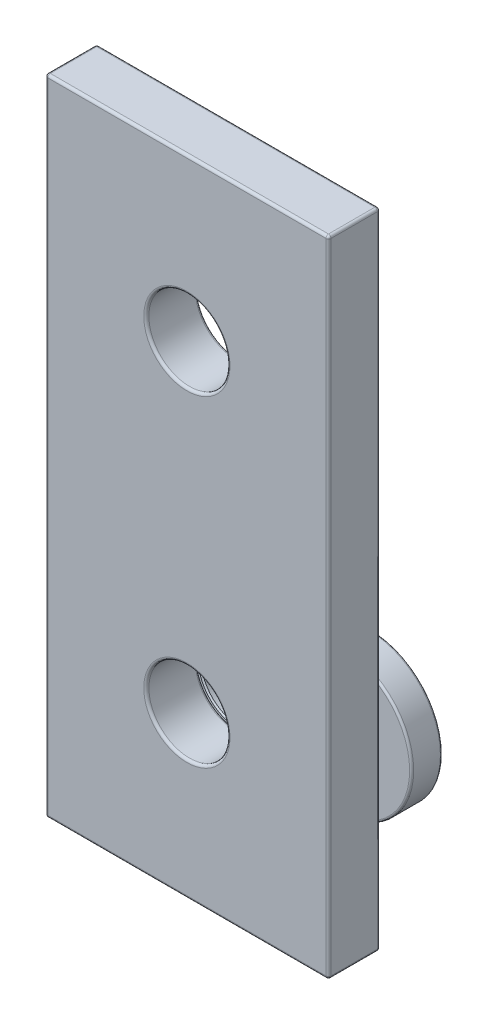
from build123d import *

# Parameters (mm, degrees)
BOSS_EXTRUDE1_DEPTH      = 2
BOSS_EXTRUDE1_DEPTH_BACK = 2
SKETCH3_W                = 22
SKETCH3_H                = 50
SKETCH16_R               = 3.15
CUT_EXTRUDE5_DEPTH       = 28.604347484
FILLET1_R                = 0.2
BOSS_EXTRUDE2_START      = -2.76
SKETCH4_R                = 3
BOSS_EXTRUDE2_DEPTH      = 2.39
SKETCH5_R                = 3.69
SKETCH5_R_2              = 3
BOSS_EXTRUDE3_DEPTH      = 0.76
FILLET2_R                = 0.1575


# Read off the part's stored shape, not the designer's step: Cut-Extrude3, Cut-Extrude4
with BuildPart() as part:
    # Sketch3 → Boss-Extrude1 (new, two sides: drawn at the far end of the back side and taken through both)
    with BuildSketch(Plane.XY.offset(-BOSS_EXTRUDE1_DEPTH_BACK)):
        Rectangle(SKETCH3_W, SKETCH3_H)
    extrude(amount=BOSS_EXTRUDE1_DEPTH + BOSS_EXTRUDE1_DEPTH_BACK)

    # Sketch16 → Cut-Extrude5 (cut, through all)
    with BuildSketch(Plane.XY.offset(2)):
        with Locations((0, -12.5)):
            Circle(SKETCH16_R)
        with Locations((0, 12.5)):
            Circle(SKETCH16_R)
    extrude(amount=-CUT_EXTRUDE5_DEPTH, mode=Mode.SUBTRACT)

    # Fillet1
    fillet1_edges = [part.edges().sort_by_distance(p)[0] for p in [
        (11, 0, 2),
        (-11, 0, -2),
        (0, 25, -2),
        (11, 0, -2),
        (0, -25, -2),
        (0, 25, 2),
        (-3.15, -12.5, -2),
        (-3.15, -12.5, 2),
        (-3.15, 12.5, -2),
        (-3.15, 12.5, 2),
        (-11, 0, 2),
        (0, -25, 2),
        (-11, 25, 0),
        (11, 25, 0),
        (11, -25, 0),
        (-11, -25, 0),
    ]]
    fillet(fillet1_edges, radius=FILLET1_R)


with BuildPart() as body_2:
    # Sketch4 → Boss-Extrude2 (new body)
    with BuildSketch(Plane.XY.offset(BOSS_EXTRUDE2_START)):
        with BuildLine():
            Line((-7.075, -18.125), (7.075, -18.125))
            ThreePointArc((7.075, -18.125), (12.7, -12.5), (7.075, -6.875))
            Line((7.075, -6.875), (-7.075, -6.875))
            ThreePointArc((-7.075, -6.875), (-12.7, -12.5), (-7.075, -18.125))
        make_face()
        with Locations((0, -12.5)):
            Circle(SKETCH4_R, mode=Mode.SUBTRACT)
    extrude(amount=-BOSS_EXTRUDE2_DEPTH)

    # Sketch5 → Boss-Extrude3 (add)
    with BuildSketch(Plane.XY.offset(-2.76)):
        with Locations((0, -12.5)):
            Circle(SKETCH5_R)
        with Locations((0, -12.5)):
            Circle(SKETCH5_R_2, mode=Mode.SUBTRACT)
    extrude(amount=BOSS_EXTRUDE3_DEPTH)

    # Fillet2
    fillet2_edges = [body_2.edges().sort_by_distance(p)[0] for p in [
        (-12.7, -12.5, -5.15),
        (0, -18.125, -5.15),
        (-3.69, -12.5, -2),
        (-3.69, -12.5, -2.76),
        (12.7, -12.5, -5.15),
        (0, -18.125, -2.76),
        (-12.7, -12.5, -2.76),
        (0, -6.875, -2.76),
        (12.7, -12.5, -2.76),
        (0, -6.875, -5.15),
    ]]
    fillet(fillet2_edges, radius=FILLET2_R)

    # Cut-Extrude3 outline → Cut-Extrude3 (revolve, cut)
    with BuildSketch(Plane.XZ.offset(12.5)):
        Polygon((3, -2), (3, -2.108253175), (3.108253175, -2), align=None)
    revolve(axis=Axis((0, -12.5, 0), (0, 0, 1)), mode=Mode.SUBTRACT)

    # Cut-Extrude4 outline → Cut-Extrude4 (revolve, cut)
    with BuildSketch(Plane.XZ.offset(12.5)):
        Polygon((3.108253175, -5.15), (3, -5.041746825), (3, -5.15), align=None)
    revolve(axis=Axis((0, -12.5, 0), (0, 0, 1)), mode=Mode.SUBTRACT)


solid = Compound([part.part, body_2.part])
